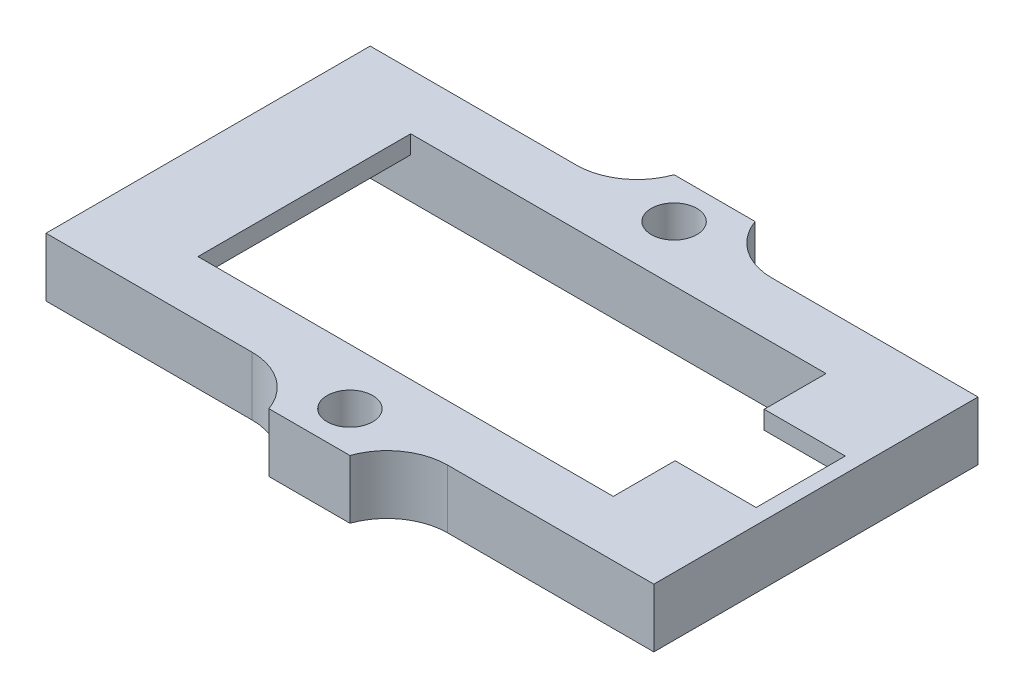
from build123d import *

# Parameters (mm, degrees)
RESSALTO_EXTRUS_O1_DEPTH = 5.8
ESBO_O2_W                = 41
ESBO_O2_H                = 21
CORTE_EXTRUS_O1_DEPTH    = 37.519036132
FILETE1_R                = 6
ESBO_O4_W                = 57
ESBO_O4_H                = 21
CORTE_EXTRUS_O2_DEPTH    = 4
ESBO_O5_W                = 16
ESBO_O5_H                = 8.8
CORTE_EXTRUS_O3_DEPTH    = 10


with BuildPart() as part:
    # Esboço1 → Ressalto-extrusão1 (new body)
    with BuildSketch(Plane(origin=(0, 0, 0), x_dir=(1, 0, 0), z_dir=(0, 1, 0))):
        with BuildLine():
            Line((-4, 20), (-4, 16))
            Line((-4, 16), (-2.25, 16))
            ThreePointArc((-2.25, 16), (0, 18.25), (2.25, 16))
            Line((2.25, 16), (4, 16))
            Line((4, 16), (4, 20))
            Line((4, 20), (-4, 20))
        make_face()
        with BuildLine():
            Line((-2.25, 16), (-4, 16))
            Line((-4, 16), (-4, 12))
            Line((-4, 12), (4, 12))
            Line((4, 12), (4, 16))
            Line((4, 16), (2.25, 16))
            ThreePointArc((2.25, 16), (0, 13.75), (-2.25, 16))
        make_face()
        Polygon((-30, 16), (-30, -16), (-4, -16), (-4, -12), (4, -12), (4, -16), (30, -16), (30, 16), (4, 16), (4, 12), (-4, 12), (-4, 16), align=None)
        with BuildLine():
            Line((-4, -12), (-4, -16))
            Line((-4, -16), (-2.25, -16))
            ThreePointArc((-2.25, -16), (0, -13.75), (2.25, -16))
            Line((2.25, -16), (4, -16))
            Line((4, -16), (4, -12))
            Line((4, -12), (-4, -12))
        make_face()
        with BuildLine():
            Line((-2.25, -16), (-4, -16))
            Line((-4, -16), (-4, -20))
            Line((-4, -20), (4, -20))
            Line((4, -20), (4, -16))
            Line((4, -16), (2.25, -16))
            ThreePointArc((2.25, -16), (0, -18.25), (-2.25, -16))
        make_face()
    extrude(amount=RESSALTO_EXTRUS_O1_DEPTH)

    # Esboço2 → Corte-extrusão1 (cut, through all)
    with BuildSketch(Plane(origin=(0, 5.8, 0), x_dir=(1, 0, 0), z_dir=(0, 1, 0))):
        Rectangle(ESBO_O2_W, ESBO_O2_H)
    extrude(amount=-CORTE_EXTRUS_O1_DEPTH, mode=Mode.SUBTRACT)

    # Filete1
    # the kernel refuses this fillet: 6 mm, written as the material it adds along each edge
    with BuildSketch(Plane(origin=(4, 0, -16), x_dir=(0, 0, -1), z_dir=(0, 1, 0))) as filete1_piece_1:
        with BuildLine():
            CenterArc((6, -5.656854249), FILETE1_R, 109.471220634, 70.528779366)
            Line((0, -5.656854249), (-0.12, -5.656854249))
            Line((-0.12, -5.656854249), (-0.12, 0))
            Line((-0.12, 0), (0, 0.12))
            ThreePointArc((0, 0.12), (2, 0.12), (3.96, 0.113137085))
            Line((3.96, 0.113137085), (4, 0))
        make_face()
    extrude(amount=5.8)
    with BuildSketch(Plane(origin=(-4, 0, -16), x_dir=(0, 0, -1), z_dir=(0, 1, 0))) as filete1_piece_2:
        with BuildLine():
            CenterArc((6, 5.656854249), FILETE1_R, 180, 70.528779366)
            Line((0, 5.656854249), (-0.12, 5.656854249))
            Line((-0.12, 5.656854249), (-0.12, 0))
            Line((-0.12, 0), (0, -0.12))
            ThreePointArc((0, -0.12), (2, -0.12), (3.96, -0.113137085))
            Line((3.96, -0.113137085), (4, 0))
        make_face()
    extrude(amount=5.8)
    with BuildSketch(Plane(origin=(-4, 0, 16), x_dir=(-1, 0, 0), z_dir=(0, 1, 0))) as filete1_piece_3:
        with BuildLine():
            CenterArc((5.656854249, 6), FILETE1_R, 199.471220634, 70.528779366)
            Line((0, 4), (-0.113137085, 3.96))
            ThreePointArc((-0.113137085, 3.96), (-0.12, 2), (-0.12, 0))
            Line((-0.12, 0), (0, -0.12))
            Line((0, -0.12), (5.656854249, -0.12))
            Line((5.656854249, -0.12), (5.656854249, 0))
        make_face()
    extrude(amount=5.8)
    with BuildSketch(Plane(origin=(4, 0, 16), x_dir=(1, 0, 0), z_dir=(0, 1, 0))) as filete1_piece_4:
        with BuildLine():
            CenterArc((5.656854249, -6), FILETE1_R, 90, 70.528779366)
            Line((0, -4), (-0.113137085, -3.96))
            ThreePointArc((-0.113137085, -3.96), (-0.12, -2), (-0.12, 0))
            Line((-0.12, 0), (0, 0.12))
            Line((0, 0.12), (5.656854249, 0.12))
            Line((5.656854249, 0.12), (5.656854249, 0))
        make_face()
    extrude(amount=5.8)

    # Esboço4 → Corte-extrusão2 (cut)
    with BuildSketch(Plane.XZ):
        Rectangle(ESBO_O4_W, ESBO_O4_H)
    extrude(amount=-CORTE_EXTRUS_O2_DEPTH, mode=Mode.SUBTRACT)

    # Esboço5 → Corte-extrusão3 (cut)
    with BuildSketch(Plane.XZ.offset(-4)):
        with Locations((20.5, 0)):
            Rectangle(ESBO_O5_W, ESBO_O5_H)
    extrude(amount=-CORTE_EXTRUS_O3_DEPTH, mode=Mode.SUBTRACT)


solid = part.part
